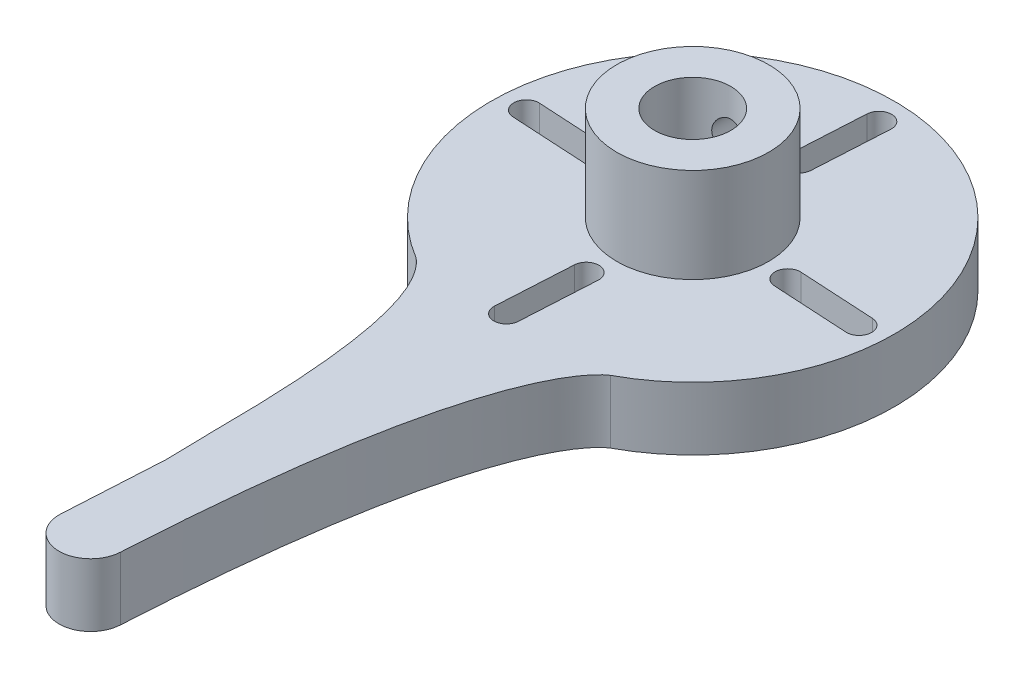
from build123d import *

# Parameters (mm, degrees)
BOSS_EXTRUDE1_OUTLINE_R = 16
BOSS_EXTRUDE1_DEPTH     = 10
SKETCH2_R               = 3.025
CUT_EXTRUDE1_DEPTH      = 25.738633754
CUT_EXTRUDE2_START      = -7.5
SKETCH3_R               = 16
SKETCH3_R_2             = 6.025
CUT_EXTRUDE2_DEPTH      = 7.5
SKETCH4_R               = 1.25
CUT_EXTRUDE3_DEPTH      = 10
CUT_EXTRUDE4_DEPTH      = 10
BOSS_EXTRUDE2_START     = -2.5
BOSS_EXTRUDE2_DEPTH     = 2.5
BOSS_EXTRUDE3_START     = 2.5
SKETCH9_R               = 3.025
BOSS_EXTRUDE3_DEPTH     = 2.5
SKETCH10_R              = 5.025
CUT_EXTRUDE5_DEPTH      = 2


# Read off the part's stored shape, not the designer's step: Boss-Extrude1, Boss-Extrude2
with BuildPart() as part:
    # Boss-Extrude1 outline → Boss-Extrude1 (new body)
    with BuildSketch(Plane(origin=(0, 0, 0), x_dir=(1, 0, 0), z_dir=(0, 1, 0))):
        Circle(BOSS_EXTRUDE1_OUTLINE_R)
    extrude(amount=BOSS_EXTRUDE1_DEPTH)

    # Sketch2 → Cut-Extrude1 (cut, through all)
    with BuildSketch(Plane(origin=(0, 10, 0), x_dir=(1, 0, 0), z_dir=(0, 1, 0))):
        with Locations(Location((0, 0, 0), (0, 0, 270))):
            Circle(SKETCH2_R)
    extrude(amount=-CUT_EXTRUDE1_DEPTH, mode=Mode.SUBTRACT)

    # Sketch3 → Cut-Extrude2 (cut)
    with BuildSketch(Plane(origin=(0, 10, 0), x_dir=(1, 0, 0), z_dir=(0, 1, 0)).offset(CUT_EXTRUDE2_START)):
        with Locations(Location((0, 0, 0), (0, 0, 270))):
            Circle(SKETCH3_R)
        with Locations(Location((0, 0, 0), (0, 0, 270))):
            Circle(SKETCH3_R_2, mode=Mode.SUBTRACT)
    extrude(amount=CUT_EXTRUDE2_DEPTH, mode=Mode.SUBTRACT)

    # Sketch4 → Cut-Extrude3 (cut)
    with BuildSketch(Plane.XY):
        with Locations((0, 6.5)):
            Circle(SKETCH4_R)
    extrude(amount=-CUT_EXTRUDE3_DEPTH, mode=Mode.SUBTRACT)

    # Sketch5 → Cut-Extrude4 (cut)
    with BuildSketch(Plane(origin=(0, 0, 0), x_dir=(-1, 0, 0), z_dir=(0, -1, 0))):
        with BuildLine():
            Line((0.210340042, 14.04358534), (0.548392997, 8.04358534))
            ThreePointArc((0.548392997, 8.04358534), (-0.393770609, 6.988915846), (-1.448440102, 7.931079452))
            Line((-1.448440102, 7.931079452), (-1.786493057, 13.931079452))
            ThreePointArc((-1.786493057, 13.931079452), (-0.844329452, 14.985748945), (0.210340042, 14.04358534))
        make_face()
        with BuildLine():
            Line((13.931079452, 1.786493057), (7.931079452, 1.448440102))
            ThreePointArc((7.931079452, 1.448440102), (6.988915846, 0.393770609), (8.04358534, -0.548392997))
            Line((8.04358534, -0.548392997), (14.04358534, -0.210340042))
            ThreePointArc((14.04358534, -0.210340042), (14.985748945, 0.844329452), (13.931079452, 1.786493057))
        make_face()
        with BuildLine():
            Line((1.786493057, -13.931079452), (1.448440102, -7.931079452))
            ThreePointArc((1.448440102, -7.931079452), (0.393770609, -6.988915846), (-0.548392997, -8.04358534))
            Line((-0.548392997, -8.04358534), (-0.210340042, -14.04358534))
            ThreePointArc((-0.210340042, -14.04358534), (0.844329452, -14.985748945), (1.786493057, -13.931079452))
        make_face()
        with BuildLine():
            Line((-13.931079452, -1.786493057), (-7.931079452, -1.448440102))
            ThreePointArc((-7.931079452, -1.448440102), (-6.988915846, -0.393770609), (-8.04358534, 0.548392997))
            Line((-8.04358534, 0.548392997), (-14.04358534, 0.210340042))
            ThreePointArc((-14.04358534, 0.210340042), (-14.985748945, -0.844329452), (-13.931079452, -1.786493057))
        make_face()
    extrude(amount=-CUT_EXTRUDE4_DEPTH, mode=Mode.SUBTRACT)

    # Boss-Extrude2 outline → Boss-Extrude2 (add)
    with BuildSketch(Plane.XZ.offset(BOSS_EXTRUDE2_START)):
        with BuildLine():
            Line((-4.70856839, 45.405985014), (-4.262641267, 37.491359232))
            add(Edge.make_bspline(
                [(-4.262641267, 37.491359232), (-4.273296685, 36.107939283), (-4.30106716, 34.802769075), (-4.343751974, 33.571480974)],
                knots=[0.099174475, 0.099174475, 0.099174475, 0.099174475, 0.155965257, 0.155965257, 0.155965257, 0.155965257], degree=3))
            add(Edge.make_bspline(
                [(-4.343751974, 33.571480974), (-4.363830382, 16.861397245), (-8.211036006, 13.732402838)],
                knots=[0.224223151, 0.224223151, 0.224223151, 0.938226666, 0.938226666, 0.938226666], degree=2))
            ThreePointArc((-8.211036006, 13.732402838), (-0.370996908, 15.995698212), (7.565543006, 14.098317596))
            add(Edge.make_bspline(
                [(0.283514356, 45.687249745), (1.800888573, 18.755833196), (6.7530796, 14.602380887), (7.565543006, 14.098317596)],
                knots=[0, 0, 0, 0, 0.916762244, 0.916762244, 0.916762244, 0.916762244], degree=3))
            ThreePointArc((0.283514356, 45.687249745), (-2.353159383, 48.042658753), (-4.70856839, 45.405985014))
        make_face()
    extrude(amount=BOSS_EXTRUDE2_DEPTH)

    # Sketch9 → Boss-Extrude3 (add)
    with BuildSketch(Plane.XZ.offset(BOSS_EXTRUDE3_START)):
        with BuildLine():
            Line((-4.70856839, 45.405985014), (-4.262641267, 37.491359232))
            add(Edge.make_bspline(
                [(-4.262641267, 37.491359232), (-4.273296685, 36.107939283), (-4.30106716, 34.802769075), (-4.343751974, 33.571480974)],
                knots=[0.099174475, 0.099174475, 0.099174475, 0.099174475, 0.155965257, 0.155965257, 0.155965257, 0.155965257], degree=3))
            add(Edge.make_bspline(
                [(-4.343751974, 33.571480974), (-4.363830382, 16.861397245), (-8.211036006, 13.732402838)],
                knots=[0, 0, 0, 1, 1, 1], degree=2))
            ThreePointArc((-8.211036006, 13.732402838), (0.370996908, -15.995698212), (7.565543006, 14.098317596))
            add(Edge.make_bspline(
                [(7.565543006, 14.098317596), (6.7530796, 14.602380887), (1.800888573, 18.755833196), (0.283514356, 45.687249745)],
                knots=[0, 0, 0, 0, 0.916762244, 0.916762244, 0.916762244, 0.916762244], degree=3))
            ThreePointArc((0.283514356, 45.687249745), (-2.353159383, 48.042658753), (-4.70856839, 45.405985014))
        make_face()
        with Locations(Location((0, 0, 0), (0, 0, 90))):
            Circle(SKETCH9_R, mode=Mode.SUBTRACT)
        with BuildLine():
            Line((-1.786493057, 13.931079452), (-1.448440102, 7.931079452))
            ThreePointArc((-1.448440102, 7.931079452), (-0.393770609, 6.988915846), (0.548392997, 8.04358534))
            Line((0.548392997, 8.04358534), (0.210340042, 14.04358534))
            ThreePointArc((0.210340042, 14.04358534), (-0.844329452, 14.985748945), (-1.786493057, 13.931079452))
        make_face(mode=Mode.SUBTRACT)
        with BuildLine():
            Line((-13.931079452, -1.786493057), (-7.931079452, -1.448440102))
            ThreePointArc((-7.931079452, -1.448440102), (-6.988915846, -0.393770609), (-8.04358534, 0.548392997))
            Line((-8.04358534, 0.548392997), (-14.04358534, 0.210340042))
            ThreePointArc((-14.04358534, 0.210340042), (-14.985748945, -0.844329452), (-13.931079452, -1.786493057))
        make_face(mode=Mode.SUBTRACT)
        with BuildLine():
            Line((1.786493057, -13.931079452), (1.448440102, -7.931079452))
            ThreePointArc((1.448440102, -7.931079452), (0.393770609, -6.988915846), (-0.548392997, -8.04358534))
            Line((-0.548392997, -8.04358534), (-0.210340042, -14.04358534))
            ThreePointArc((-0.210340042, -14.04358534), (0.844329452, -14.985748945), (1.786493057, -13.931079452))
        make_face(mode=Mode.SUBTRACT)
        with BuildLine():
            Line((13.931079452, 1.786493057), (7.931079452, 1.448440102))
            ThreePointArc((7.931079452, 1.448440102), (6.988915846, 0.393770609), (8.04358534, -0.548392997))
            Line((8.04358534, -0.548392997), (14.04358534, -0.210340042))
            ThreePointArc((14.04358534, -0.210340042), (14.985748945, 0.844329452), (13.931079452, 1.786493057))
        make_face(mode=Mode.SUBTRACT)
    extrude(amount=-BOSS_EXTRUDE3_DEPTH)

    # Sketch10 → Cut-Extrude5 (cut)
    with BuildSketch(Plane.XZ.offset(2.5)):
        with Locations(Location((0, 0, 0), (0, 0, 270))):
            Circle(SKETCH10_R)
    extrude(amount=-CUT_EXTRUDE5_DEPTH, mode=Mode.SUBTRACT)


solid = part.part
